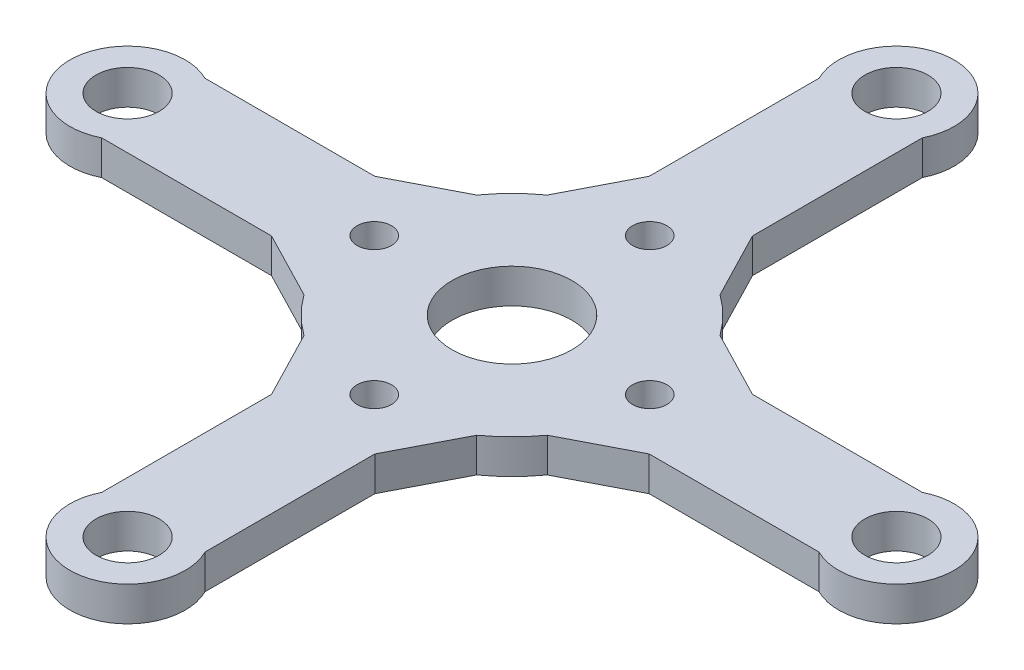
from build123d import *

# Parameters (mm, degrees)
SKETCH1_R           = 2.75
BOSS_EXTRUDE1_DEPTH = 3
SKETCH5_R           = 5.226301297
SKETCH5_R_2         = 1.5
CUT_EXTRUDE2_DEPTH  = 7.2


with BuildPart() as part:
    # Sketch1 → Boss-Extrude1 (new body)
    with BuildSketch(Plane(origin=(0, 0, 0), x_dir=(1, 0, 0), z_dir=(0, 1, 0))):
        with BuildLine():
            Line((-4.5, 31.251652173), (-4.5, 12.196310918))
            ThreePointArc((-4.5, 12.196310918), (-9.192388155, 9.192388155), (-12.196310918, 4.5))
            Line((-12.196310918, 4.5), (-31.251652173, 4.5))
            ThreePointArc((-31.251652173, 4.5), (-38.523072163, 0), (-31.251652173, -4.5))
            Line((-31.251652173, -4.5), (-12.196310918, -4.5))
            ThreePointArc((-12.196310918, -4.5), (-9.192388155, -9.192388155), (-4.5, -12.196310918))
            Line((-4.5, -12.196310918), (-4.5, -31.251652173))
            ThreePointArc((-4.5, -31.251652173), (0, -38.523072163), (4.5, -31.251652173))
            Line((4.5, -31.251652173), (4.5, -12.196310918))
            ThreePointArc((4.5, -12.196310918), (9.192388155, -9.192388155), (12.196310918, -4.5))
            Line((12.196310918, -4.5), (31.251652173, -4.5))
            ThreePointArc((31.251652173, -4.5), (38.523072163, 0), (31.251652173, 4.5))
            Line((31.251652173, 4.5), (12.196310918, 4.5))
            ThreePointArc((12.196310918, 4.5), (9.192388155, 9.192388155), (4.5, 12.196310918))
            Line((4.5, 12.196310918), (4.5, 31.251652173))
            ThreePointArc((4.5, 31.251652173), (0, 38.523072163), (-4.5, 31.251652173))
        make_face()
        with Locations(Location((0, -33.494924376, 0), (0, 0, 270))):
            Circle(SKETCH1_R, mode=Mode.SUBTRACT)
        with Locations(Location((-33.494924376, 0, 0), (0, 0, 270))):
            Circle(SKETCH1_R, mode=Mode.SUBTRACT)
        with Locations(Location((0, 33.494924376, 0), (0, 0, 270))):
            Circle(SKETCH1_R, mode=Mode.SUBTRACT)
        with Locations(Location((33.494924376, 0, 0), (0, 0, 270))):
            Circle(SKETCH1_R, mode=Mode.SUBTRACT)
    extrude(amount=BOSS_EXTRUDE1_DEPTH)

    # Chamfer1
    # the kernel refuses this chamfer: 5 mm, written as the material it adds along each edge
    with BuildSketch(Plane(origin=(-12.196310918, 0, -4.5), x_dir=(0.4944512114841002, 0, -0.869205383935181), z_dir=(0, 1, 0)), Plane(origin=(4.5, 0, -12.196310918), x_dir=(0.8692053839351812, 0, 0.4944512114841002), z_dir=(0, 1, 0)), Plane(origin=(12.196310918, 0, 4.5), x_dir=(-0.4944512114841005, 0, 0.869205383935181), z_dir=(0, 1, 0)), Plane(origin=(-4.5, 0, 12.196310918), x_dir=(-0.869205383935182, 0, -0.4944512114840988), z_dir=(0, 1, 0))) as chamfer1_piece_1:
        with BuildLine():
            Line((3.583193205, 0), (-2.272552352, 3.809310984))
            Line((-2.272552352, 3.809310984), (-2.359472891, 3.759865863))
            ThreePointArc((-2.359472891, 3.759865863), (-1.183301792, 1.877904769), (-0.086920538, -0.049445121))
            Line((-0.086920538, -0.049445121), (0.016300434, -0.098662535))
            ThreePointArc((0.016300434, -0.098662535), (1.789817923, 0.069668276), (3.573220218, -0.099501455))
            Line((3.573220218, -0.099501455), (3.583193205, 0))
        make_face()
    extrude(amount=3)
    with BuildSketch(Plane(origin=(-4.5, 0, -12.196310918), x_dir=(0.020694934032123476, 0, -0.9997858369197905), z_dir=(0, 1, 0)), Plane(origin=(12.196310918, 0, -4.5), x_dir=(0.9997858369197905, 0, 0.020694934032131303), z_dir=(0, 1, 0)), Plane(origin=(4.5, 0, 12.196310918), x_dir=(-0.020694934032078793, 0, 0.9997858369197915), z_dir=(0, 1, 0)), Plane(origin=(-12.196310918, 0, 4.5), x_dir=(-0.9997858369197906, 0, -0.020694934032118258), z_dir=(0, 1, 0))) as chamfer1_piece_2:
        with BuildLine():
            Line((4.435689841, 0), (-1.835789795, 3.077198299))
            Line((-1.835789795, 3.077198299), (-1.916130816, 3.017655706))
            ThreePointArc((-1.916130816, 3.017655706), (-0.857153439, 1.572765033), (-0.093081321, -0.036549524))
            Line((-0.093081321, -0.036549524), (0.002069493, -0.099978584))
            ThreePointArc((0.002069493, -0.099978584), (2.218964555, -0.054090259), (4.437759335, -0.099978584))
            Line((4.437759335, -0.099978584), (4.435689841, 0))
        make_face()
    extrude(amount=3)

    # Sketch5 → Cut-Extrude2 (cut)
    with BuildSketch(Plane(origin=(0, 3, 0), x_dir=(1, 0, 0), z_dir=(0, 1, 0))):
        with Locations(Location((0, 0, 0), (0, 0, 270))):
            Circle(SKETCH5_R)
        with Locations(Location((-1.03e-07, 12, 0), (0, 0, 270))):
            Circle(SKETCH5_R_2)
        with Locations(Location((12, 1.03e-07, 0), (0, 0, 270))):
            Circle(SKETCH5_R_2)
        with Locations(Location((1.03e-07, -12, 0), (0, 0, 270))):
            Circle(SKETCH5_R_2)
        with Locations(Location((-12, -1.03e-07, 0), (0, 0, 270))):
            Circle(SKETCH5_R_2)
    extrude(amount=-CUT_EXTRUDE2_DEPTH, mode=Mode.SUBTRACT)


solid = part.part
